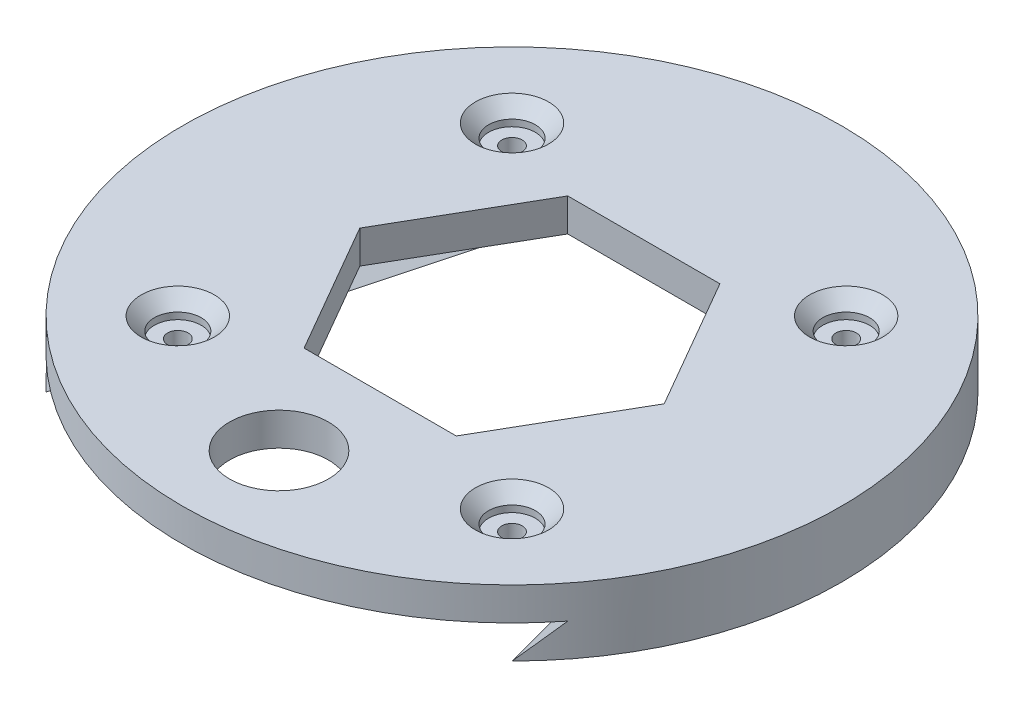
from build123d import *

# Parameters (mm, degrees)
SKETCH1_R               = 50
BOSS_EXTRUDE1_DEPTH     = 5
BOSS_EXTRUDE2_START     = -5
BOSS_EXTRUDE2_DEPTH     = 5
DRAFT1_ANGLE            = -45
CUT_EXTRUDE2_DEPTH      = 71.887234394
CUT_EXTRUDE2_DEPTH_BACK = 71.887234394
SKETCH1_8_R             = 7.5
CUT_EXTRUDE3_DEPTH      = 71.887234394
SKETCH3_R               = 3.55
SKETCH3_R_2             = 1.55
CUT_EXTRUDE4_DEPTH      = 3
SKETCH3_3_R             = 1.55
CUT_EXTRUDE6_DEPTH      = 72.414284285
CHAMFER1_SIZE           = 2


with BuildPart() as part:
    # Sketch1 → Boss-Extrude1 (new body)
    with BuildSketch(Plane(origin=(0, 0, 0), x_dir=(1, 0, 0), z_dir=(0, 1, 0))):
        Circle(SKETCH1_R)
    extrude(amount=BOSS_EXTRUDE1_DEPTH)

    # Sketch1<5> → Boss-Extrude2 (add)
    with BuildSketch(Plane(origin=(0, 0, 0), x_dir=(1, 0, 0), z_dir=(0, 1, 0)).offset(BOSS_EXTRUDE2_START)):
        with BuildLine():
            ThreePointArc((-12.940952255, 48.296291314), (-48.296291314, 12.940952255), (-35.355339059, -35.355339059))
            Line((-35.355339059, -35.355339059), (-12.940952255, 48.296291314))
        make_face()
        with BuildLine():
            Line((12.940952255, 48.296291314), (35.355339059, -35.355339059))
            ThreePointArc((35.355339059, -35.355339059), (48.296291314, 12.940952255), (12.940952255, 48.296291314))
        make_face()
    extrude(amount=BOSS_EXTRUDE2_DEPTH)

    # Draft1
    draft1_faces = [part.faces().sort_by_distance(p)[0] for p in [
        (24.148145657, -2.5, -6.470476128),
        (-24.148145657, -2.5, -6.470476128),
    ]]
    draft(draft1_faces, Plane(origin=(0, -5, 0), x_dir=(0, 0, -1), z_dir=(0, -1, 0)), DRAFT1_ANGLE)

    # Sketch1<8> → Cut-Extrude2 (cut, two sides: drawn at the far end of the back side and taken through both)
    with BuildSketch(Plane(origin=(0, 0, 0), x_dir=(1, 0, 0), z_dir=(0, 1, 0)).offset(-CUT_EXTRUDE2_DEPTH_BACK)):
        with Locations((0, -35.355339059)):
            Circle(SKETCH1_8_R)
    extrude(amount=CUT_EXTRUDE2_DEPTH + CUT_EXTRUDE2_DEPTH_BACK, mode=Mode.SUBTRACT)

    # Sketch2 → Cut-Extrude3 (cut, through all)
    with BuildSketch(Plane.XZ):
        Polygon((23.094010768, 0), (11.547005384, 20), (-11.547005384, 20), (-23.094010768, 0), (-11.547005384, -20), (11.547005384, -20), align=None)
    extrude(amount=-CUT_EXTRUDE3_DEPTH, mode=Mode.SUBTRACT)

    # Sketch3 → Cut-Extrude4 (cut)
    # profile 1 of 4: a face of its own
    with BuildSketch(Plane(origin=(0, 5, 0), x_dir=(1, 0, 0), z_dir=(0, 1, 0))):
        with Locations((-25.355339059, 25.355339059)):
            Circle(SKETCH3_R)
        with Locations((-25.355339059, 25.355339059)):
            Circle(SKETCH3_R_2, mode=Mode.SUBTRACT)
    # profile 2 of 4: a face of its own
    with BuildSketch(Plane(origin=(0, 5, 0), x_dir=(1, 0, 0), z_dir=(0, 1, 0))):
        with Locations((25.355339059, 25.355339059)):
            Circle(SKETCH3_R)
        with Locations((25.355339059, 25.355339059)):
            Circle(SKETCH3_R_2, mode=Mode.SUBTRACT)
    # profile 3 of 4: a face of its own
    with BuildSketch(Plane(origin=(0, 5, 0), x_dir=(1, 0, 0), z_dir=(0, 1, 0))):
        with Locations((25.355339059, -25.355339059)):
            Circle(SKETCH3_R)
        with Locations((25.355339059, -25.355339059)):
            Circle(SKETCH3_R_2, mode=Mode.SUBTRACT)
    # profile 4 of 4: a face of its own
    with BuildSketch(Plane(origin=(0, 5, 0), x_dir=(1, 0, 0), z_dir=(0, 1, 0))):
        with Locations((-25.355339059, -25.355339059)):
            Circle(SKETCH3_R)
        with Locations((-25.355339059, -25.355339059)):
            Circle(SKETCH3_R_2, mode=Mode.SUBTRACT)
    extrude(amount=-CUT_EXTRUDE4_DEPTH, mode=Mode.SUBTRACT)

    # Sketch3<3> → Cut-Extrude6 (cut, through all)
    with BuildSketch(Plane(origin=(0, 5, 0), x_dir=(1, 0, 0), z_dir=(0, 1, 0))):
        with Locations((-25.355339059, 25.355339059)):
            Circle(SKETCH3_3_R)
        with Locations((25.355339059, 25.355339059)):
            Circle(SKETCH3_3_R)
        with Locations((25.355339059, -25.355339059)):
            Circle(SKETCH3_3_R)
        with Locations((-25.355339059, -25.355339059)):
            Circle(SKETCH3_3_R)
    extrude(amount=-CUT_EXTRUDE6_DEPTH, mode=Mode.SUBTRACT)

    # Chamfer1
    chamfer1_edges = [part.edges().sort_by_distance(p)[0] for p in [
        (21.805339059, 5, -25.355339059),
        (-28.905339059, 5, -25.355339059),
        (-28.905339059, 5, 25.355339059),
        (21.805339059, 5, 25.355339059),
    ]]
    chamfer(chamfer1_edges, length=CHAMFER1_SIZE)


solid = part.part
